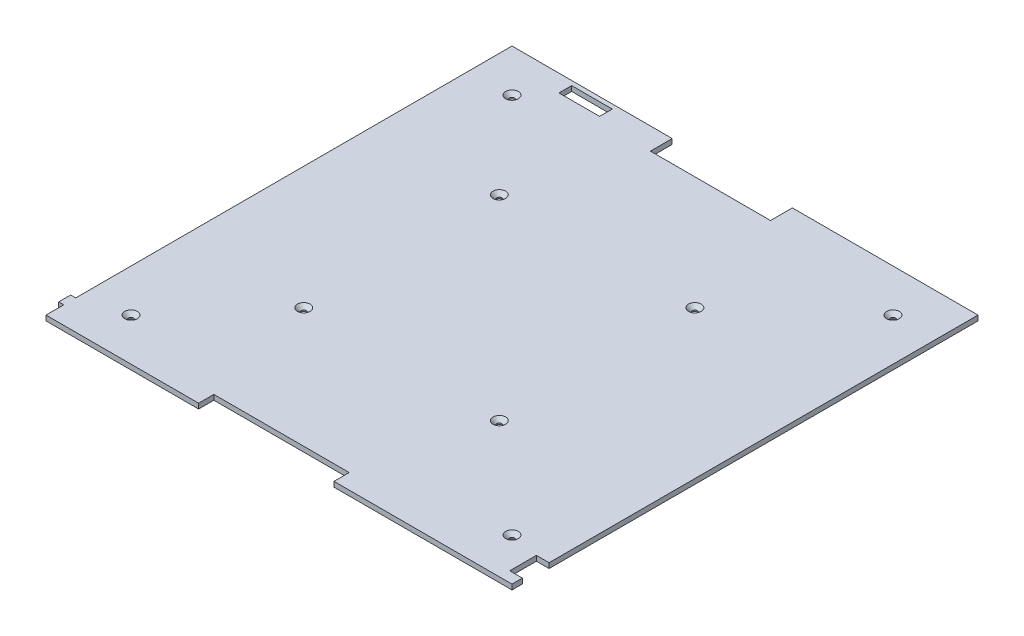
from build123d import *

# Parameters (mm, degrees)
BOSS_EXTRUDE1_DEPTH = 2
SKETCH2_R           = 1
CUT_EXTRUDE1_DEPTH  = 132.191177295
CHAMFER1_SIZE       = 1.5
SKETCH3_W           = 16
SKETCH3_H           = 5
CUT_EXTRUDE2_DEPTH  = 132.191177295
SKETCH4_W           = 7.628930623
SKETCH4_H           = 40
CUT_EXTRUDE3_DEPTH  = 1.4


with BuildPart() as part:
    # Sketch1 → Boss-Extrude1 (new body)
    with BuildSketch(Plane(origin=(0, 0, 0), x_dir=(1, 0, 0), z_dir=(0, 1, 0))):
        Polygon((-91.75, 91.75), (-91.75, -80.05), (-93.75, -80.05), (-93.75, -84.75), (-91.75, -84.75), (-91.75, -91.75), (-31.65, -91.75), (-31.65, -85.75), (21.65, -85.75), (21.65, -91.75), (91.75, -91.75), (91.75, -87.65), (86.75, -87.65), (86.75, -77.15), (91.75, -77.15), (91.75, 91.75), (18.65, 91.75), (18.65, 83.15), (-28.65, 83.15), (-28.65, 91.75), align=None)
    extrude(amount=BOSS_EXTRUDE1_DEPTH)

    # Sketch2 → Cut-Extrude1 (cut, through all)
    with BuildSketch(Plane.XZ):
        with Locations((75, -75)):
            Circle(SKETCH2_R)
        with Locations((-75, -75)):
            Circle(SKETCH2_R)
        with Locations((-75, 75)):
            Circle(SKETCH2_R)
        with Locations((75, 75)):
            Circle(SKETCH2_R)
        with Locations((33.5, -38.5)):
            Circle(SKETCH2_R)
        with Locations((33.5, 38.5)):
            Circle(SKETCH2_R)
        with Locations((-43.5, -38.5)):
            Circle(SKETCH2_R)
        with Locations((-43.5, 38.5)):
            Circle(SKETCH2_R)
    extrude(amount=-CUT_EXTRUDE1_DEPTH, mode=Mode.SUBTRACT)

    # Chamfer1
    chamfer1_edges = [part.edges().sort_by_distance(p)[0] for p in [
        (74, 2, -75),
        (32.5, 2, -38.5),
        (74, 2, 75),
        (32.5, 2, 38.5),
        (-44.5, 2, 38.5),
        (-44.5, 2, -38.5),
        (-76, 2, -75),
        (-76, 2, 75),
    ]]
    chamfer(chamfer1_edges, length=CHAMFER1_SIZE)

    # Sketch3 → Cut-Extrude2 (cut, through all)
    with BuildSketch(Plane.XZ):
        with Locations((-58.5, -87.5)):
            Rectangle(SKETCH3_W, SKETCH3_H)
    extrude(amount=-CUT_EXTRUDE2_DEPTH, mode=Mode.SUBTRACT)

    # Sketch4 → Cut-Extrude3 (cut)
    with BuildSketch(Plane.XZ):
        with Locations((-43.615138368, 0.25)):
            Rectangle(SKETCH4_W, SKETCH4_H)
    extrude(amount=-CUT_EXTRUDE3_DEPTH, mode=Mode.SUBTRACT)


solid = part.part
